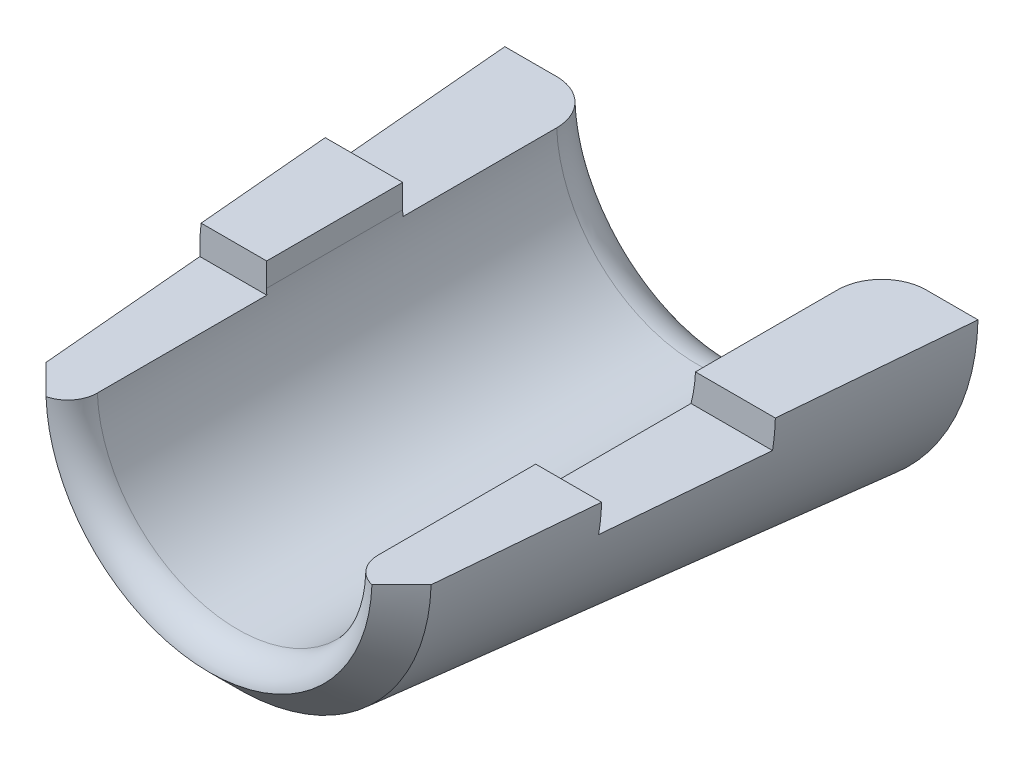
from build123d import *

# Parameters (mm, degrees)
SKETCH3_R               = 4.75
WIRE_HOLE_CUT_DEPTH     = 22.260291625
FRONT_STRAIN_FILLET_R   = 1
REAR_STRAIN_FILLET_R    = 1.5
SPLIT_CUT_1_DEPTH       = 22.260291625
SPLIT_CUT_2_DEPTH       = 22.26029171
WIRE_INSERT_NOTCH_DEPTH = 22.259351006


with BuildPart() as part:
    # Sketch2 → Body Revolve1 (revolve)
    with BuildSketch(Plane(origin=(0, 0, 0), x_dir=(0, 0, -1), z_dir=(1, 0, 0)), mode=Mode.PRIVATE) as body_revolve1_sk:
        Polygon((0, 0), (-18, 0), (-18, 5.51269272), (-17, 6.51269272), (0, 8), align=None)
    revolve(body_revolve1_sk.sketch.rotate(Axis((0, 0, 18), (0, 0, 1)), 90), axis=Axis((0, 0, 18), (0, 0, 1)))

    # Sketch3 → Wire Hole Cut (cut, through all)
    with BuildSketch(Plane.XY):
        Circle(SKETCH3_R)
    extrude(amount=WIRE_HOLE_CUT_DEPTH, mode=Mode.SUBTRACT)

    # Front Strain Fillet
    # the kernel refuses this fillet: 1 mm, written as the material it takes off along each edge
    with BuildSketch(Plane(origin=(0, 0, 18), x_dir=(1, 0, 0), z_dir=(0, 1, 0))) as front_strain_fillet_piece_1:
        with BuildLine():
            CenterArc((5.75, 0.971434637), FRONT_STRAIN_FILLET_R, 180, 76.272331842)
            Line((4.75, 0.971434637), (4.73, 0.971434637))
            Line((4.73, 0.971434637), (4.73, 0))
            Line((4.73, 0), (4.75, -0.02))
            ThreePointArc((4.75, -0.02), (5.13134636, -0.02), (5.507946574, -0.019428693))
            Line((5.507946574, -0.019428693), (5.51269272, 0))
        make_face()
    revolve(axis=Axis((0, 0, 18), (0, 0, -1)), mode=Mode.SUBTRACT)

    # Rear Strain Fillet
    rear_strain_fillet_edges = [part.edges().sort_by_distance(p)[0] for p in [
        (-4.75, 0, 0),
    ]]
    fillet(rear_strain_fillet_edges, radius=REAR_STRAIN_FILLET_R)

    # Sketch5 → Split Cut 1 (cut, through all)
    with BuildSketch(Plane(origin=(0, 0, 0), x_dir=(0, 0, -1), z_dir=(1, 0, 0))):
        Polygon((-18, 0), (-11.5, 0), (-11.5, 1), (-6.5, 1), (-6.5, 0), (0, 0), (0, -0.2), (-6.7, -0.2), (-6.7, 0.8), (-11.3, 0.8), (-11.3, -0.2), (-18, -0.2), align=None)
    extrude(amount=-SPLIT_CUT_1_DEPTH, mode=Mode.SUBTRACT)

    # Sketch7 → Split Cut 2 (cut, through all)
    with BuildSketch(Plane(origin=(0, 0, 0), x_dir=(0, 0, -1), z_dir=(1, 0, 0))):
        Polygon((-18, 0), (-11.5, 0), (-11.5, -1), (-6.5, -1), (-6.5, 0), (0, 0), (0, -0.2), (-6.3, -0.2), (-6.3, -1.2), (-11.7, -1.2), (-11.7, -0.2), (-18, -0.2), align=None)
    extrude(amount=SPLIT_CUT_2_DEPTH, mode=Mode.SUBTRACT)


with BuildPart() as split_cut_2_kept_piece:
    # of the separate pieces the step leaves, the one the design keeps (split_cut_2_pieces_kept)
    add(part.part.solids().sort_by_distance((6.24679918, -0.2, 0))[0])

    # Sketch6 → Wire Insert Notch (cut, through all)
    with BuildSketch(Plane.XY):
        with BuildLine():
            Line((-4.75, 0), (-4.75, 2))
            Line((-4.75, 2), (4.75, 2))
            Line((4.75, 2), (4.75, 0))
            ThreePointArc((4.75, 0), (0, -4.75), (-4.75, 0))
        make_face()
    extrude(amount=WIRE_INSERT_NOTCH_DEPTH, mode=Mode.SUBTRACT)


solid = split_cut_2_kept_piece.part
